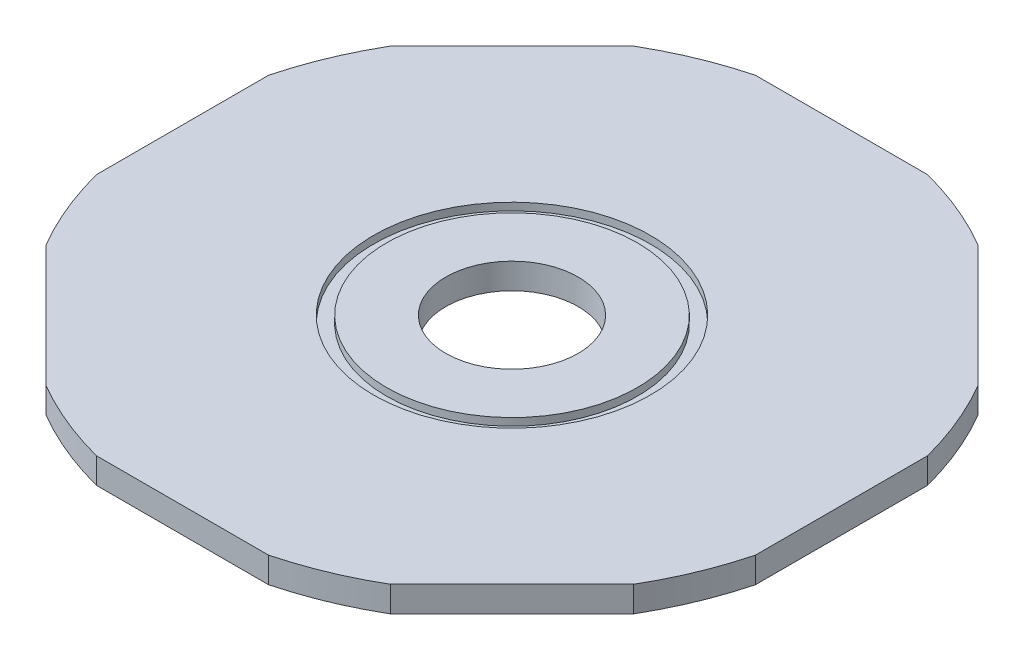
from build123d import *

# Parameters (mm, degrees)
BOSS_EXTRUDE1_DEPTH = 9.525
SKETCH3_R           = 24.5745
CUT_EXTRUDE1_DEPTH  = 174.2203961
SKETCH5_R           = 51.3715
SKETCH5_R_2         = 46.5455
CUT_EXTRUDE2_DEPTH  = 2.794
SKETCH7_R           = 3.714668429
CUT_EXTRUDE3_DEPTH  = 3.175
CIRPATTERN1_COUNT   = 8


with BuildPart() as part:
    # Sketch1 → Boss-Extrude1 (new body)
    with BuildSketch(Plane(origin=(0, 0, 0), x_dir=(1, 0, 0), z_dir=(0, 1, 0))):
        with BuildLine():
            ThreePointArc((-31.932272077, 122.3), (-48.371185851, 116.778372909), (-63.899633215, 109.058685463))
            Line((-63.899633215, 109.058685463), (-109.058685463, 63.899633215))
            ThreePointArc((-109.058685463, 63.899633215), (-116.778372909, 48.371185851), (-122.3, 31.932272077))
            Line((-122.3, 31.932272077), (-122.3, -31.932272077))
            ThreePointArc((-122.3, -31.932272077), (-116.778372909, -48.371185851), (-109.058685463, -63.899633215))
            Line((-109.058685463, -63.899633215), (-63.899633215, -109.058685463))
            ThreePointArc((-63.899633215, -109.058685463), (-48.371185851, -116.778372909), (-31.932272077, -122.3))
            Line((-31.932272077, -122.3), (31.932272077, -122.3))
            ThreePointArc((31.932272077, -122.3), (48.371185851, -116.778372909), (63.899633215, -109.058685463))
            Line((63.899633215, -109.058685463), (109.058685463, -63.899633215))
            ThreePointArc((109.058685463, -63.899633215), (116.778372909, -48.371185851), (122.3, -31.932272077))
            Line((122.3, -31.932272077), (122.3, 31.932272077))
            ThreePointArc((122.3, 31.932272077), (116.778372909, 48.371185851), (109.058685463, 63.899633215))
            Line((109.058685463, 63.899633215), (63.899633215, 109.058685463))
            ThreePointArc((63.899633215, 109.058685463), (48.371185851, 116.778372909), (31.932272077, 122.3))
            Line((31.932272077, 122.3), (-31.932272077, 122.3))
        make_face()
    extrude(amount=BOSS_EXTRUDE1_DEPTH)

    # Sketch3 → Cut-Extrude1 (cut, through all)
    with BuildSketch(Plane(origin=(0, 9.525, 0), x_dir=(1, 0, 0), z_dir=(0, 1, 0))):
        Circle(SKETCH3_R)
    extrude(amount=-CUT_EXTRUDE1_DEPTH, mode=Mode.SUBTRACT)

    # Sketch5 → Cut-Extrude2 (cut)
    with BuildSketch(Plane(origin=(0, 9.525, 0), x_dir=(1, 0, 0), z_dir=(0, 1, 0))):
        Circle(SKETCH5_R)
        Circle(SKETCH5_R_2, mode=Mode.SUBTRACT)
    extrude(amount=-CUT_EXTRUDE2_DEPTH, mode=Mode.SUBTRACT)

    # Sketch7 → Cut-Extrude3 (cut)
    with BuildSketch(Plane.XZ):
        with Locations((0, 45.790698066)):
            Circle(SKETCH7_R)
    cut_extrude3 = extrude(amount=-CUT_EXTRUDE3_DEPTH, mode=Mode.SUBTRACT)

    # CirPattern1: Cut-Extrude3 ×8 about axis
    cirpattern1_axis = Axis((0, 0, 0), (0, 1, 0))
    for i in range(1, CIRPATTERN1_COUNT):
        add(cut_extrude3.rotate(cirpattern1_axis, i * 360 / CIRPATTERN1_COUNT), mode=Mode.SUBTRACT)


solid = part.part
